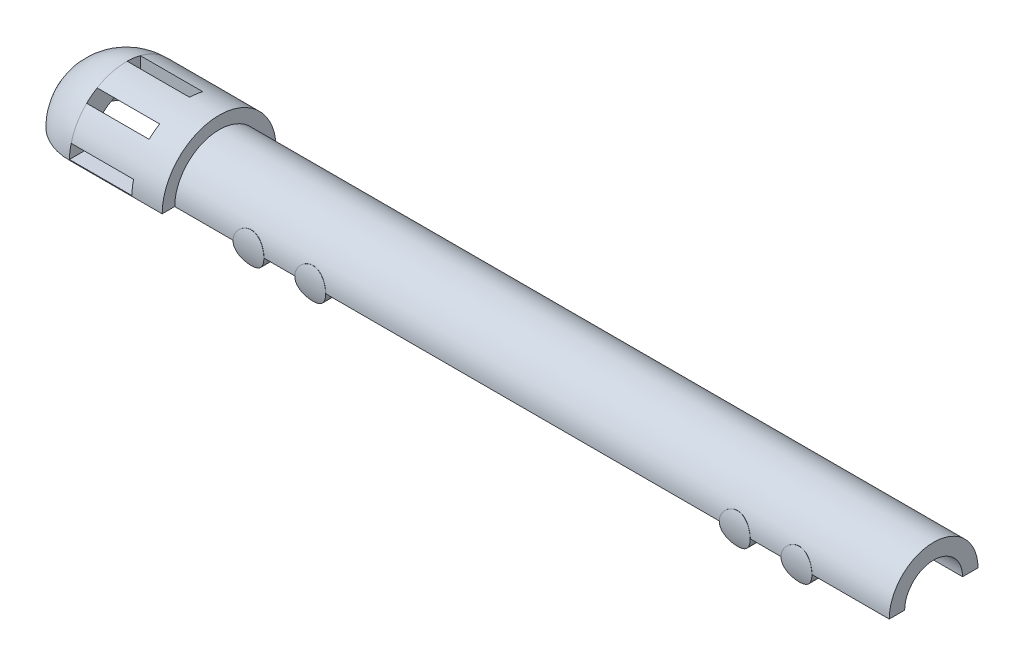
from build123d import *

# Parameters (mm, degrees)
REVOLVE6_ANGLE      = 180
SKETCH2_W           = 8.091492299
SKETCH2_H           = 1.703338147
CUT_EXTRUDE1_DEPTH  = 10
CIRPATTERN1_COUNT   = 8
SKETCH3_R           = 2
BOSS_EXTRUDE2_DEPTH = 10
CUT_EXTRUDE7_START  = -5
SKETCH7_R           = 3.763722409
CUT_EXTRUDE7_DEPTH  = 80
SKETCH8_R           = 14.81574256
SKETCH8_R_2         = 5.771530568
CUT_EXTRUDE12_DEPTH = 90


with BuildPart() as part:
    # Sketch1 → Revolve6 (revolve)
    with BuildSketch(Plane(origin=(0, 0, 0), x_dir=(1, 0, 0), z_dir=(0, 1, 0))):
        with BuildLine():
            Line((-7.909078058, 1.25), (72.687823808, 1.25))
            Line((72.687823808, 1.25), (72.687823808, 0))
            Line((72.687823808, 0), (74.913959146, 0))
            Line((74.913959146, 0), (74.913959146, 1.25))
            Line((74.913959146, 1.25), (78.913959146, 1.25))
            Line((78.913959146, 1.25), (78.913959146, 3.25))
            Line((78.913959146, 3.25), (74.913959146, 3.25))
            Line((74.913959146, 3.25), (-13.655190787, 3.25))
            Line((-13.655190787, 3.25), (-13.655190787, 4.88))
            Line((-13.655190787, 4.88), (-16.655190787, 4.88))
            Line((-16.655190787, 4.88), (-25.666337235, 4.88))
            ThreePointArc((-25.666337235, 4.88), (-30.88478528, 2.718448045), (-33.046337235, -2.5))
            Line((-33.046337235, -2.5), (-30.045517155, -2.5))
            ThreePointArc((-30.045517155, -2.5), (-28.762885052, 0.596547817), (-25.666337235, 1.87917992))
            Line((-25.666337235, 1.87917992), (-16.655190787, 1.87917992))
            Line((-16.655190787, 1.87917992), (-16.655190787, 1.25))
            Line((-16.655190787, 1.25), (-12.636458182, 1.25))
            Line((-12.636458182, 1.25), (-12.636458182, 0))
            Line((-12.636458182, 0), (-10.911424866, 0))
            Line((-10.911424866, 0), (-10.911424866, 1.25))
            Line((-10.911424866, 1.25), (-7.909078058, 1.25))
        make_face()
    revolve(axis=Axis((-33.046337235, 0, 2.5), (1, 0, 0)), revolution_arc=REVOLVE6_ANGLE)

    # Sketch2 → Cut-Extrude1 (cut)
    with BuildSketch(Plane(origin=(0, 0, 0), x_dir=(1, 0, 0), z_dir=(0, 1, 0))):
        with Locations((-21.620591086, -1.552211442)):
            Rectangle(SKETCH2_W, SKETCH2_H)
    cut_extrude1 = extrude(amount=CUT_EXTRUDE1_DEPTH, mode=Mode.SUBTRACT)

    # CirPattern1: Cut-Extrude1 ×8 about axis
    cirpattern1_axis = Axis((-25.666337235, 0, 2.5), (-1, 0, 0))
    for i in range(1, CIRPATTERN1_COUNT):
        add(cut_extrude1.rotate(cirpattern1_axis, i * 360 / CIRPATTERN1_COUNT), mode=Mode.SUBTRACT)

    # Sketch3 → Boss-Extrude2 (add, symmetric)
    with BuildSketch(Plane.XY):
        with Locations((66.913959146, 0)):
            Circle(SKETCH3_R)
        with Locations((58.913959146, 0)):
            Circle(SKETCH3_R)
        with Locations((3.913959146, 0)):
            Circle(SKETCH3_R)
        with Locations((-4.086040854, 0)):
            Circle(SKETCH3_R)
    extrude(amount=BOSS_EXTRUDE2_DEPTH, both=True)

    # Sketch7 → Cut-Extrude7 (cut)
    with BuildSketch(Plane(origin=(74.913959146, 0, 0), x_dir=(0, 0, -1), z_dir=(1, 0, 0)).offset(CUT_EXTRUDE7_START)):
        with Locations((-2.5, 0)):
            Circle(SKETCH7_R)
    extrude(amount=-CUT_EXTRUDE7_DEPTH, mode=Mode.SUBTRACT)

    # Sketch8 → Cut-Extrude12 (cut)
    with BuildSketch(Plane(origin=(78.913959146, 0, 0), x_dir=(0, 0, -1), z_dir=(1, 0, 0))):
        with Locations((-2.5, 0)):
            Circle(SKETCH8_R)
        with Locations((-2.5, 0)):
            Circle(SKETCH8_R_2, mode=Mode.SUBTRACT)
    extrude(amount=-CUT_EXTRUDE12_DEPTH, mode=Mode.SUBTRACT)


solid = part.part
